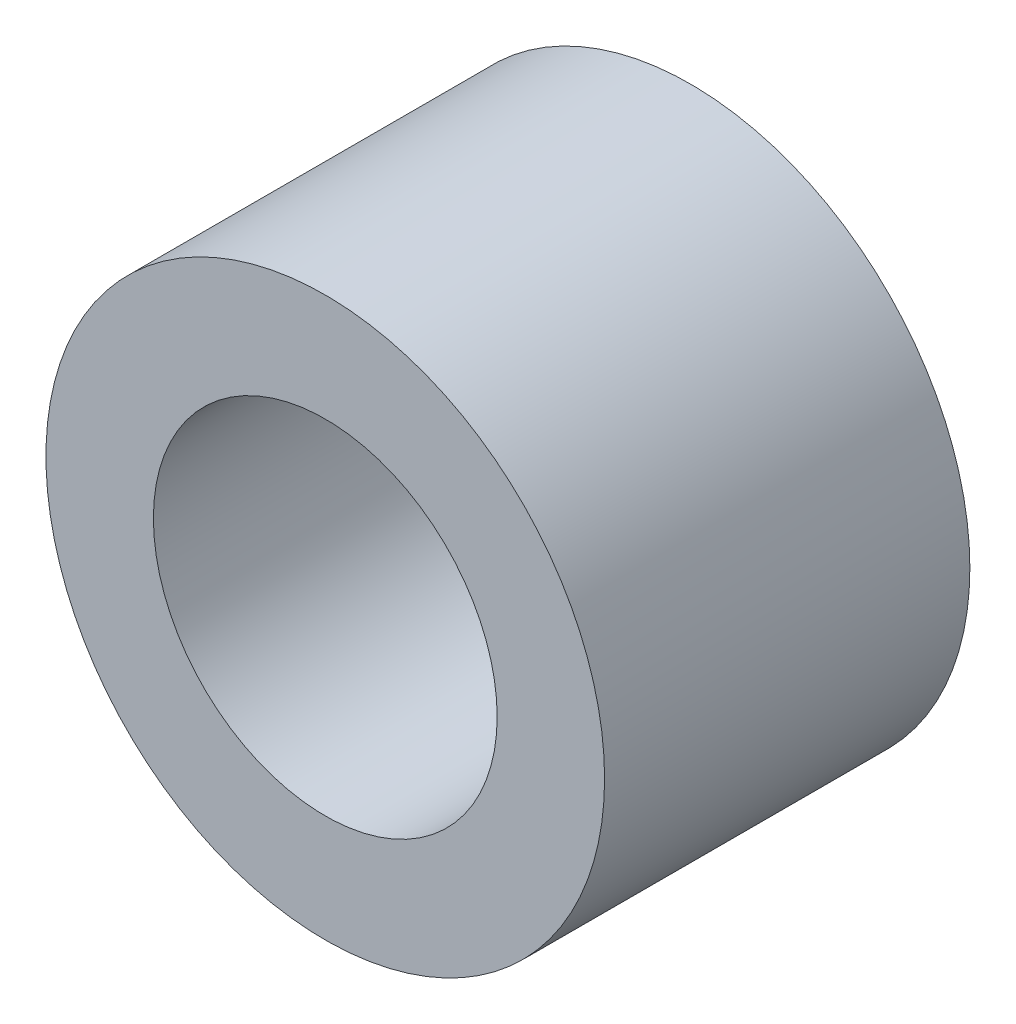
from build123d import *

# Parameters (mm, degrees)
SKETCH1_R           = 6.5
SKETCH1_R_2         = 4
BOSS_EXTRUDE1_DEPTH = 4.25


with BuildPart() as part:
    # Sketch1 → Boss-Extrude1 (new, symmetric)
    with BuildSketch(Plane.XY):
        Circle(SKETCH1_R)
        Circle(SKETCH1_R_2, mode=Mode.SUBTRACT)
    extrude(amount=BOSS_EXTRUDE1_DEPTH, both=True)


solid = part.part
